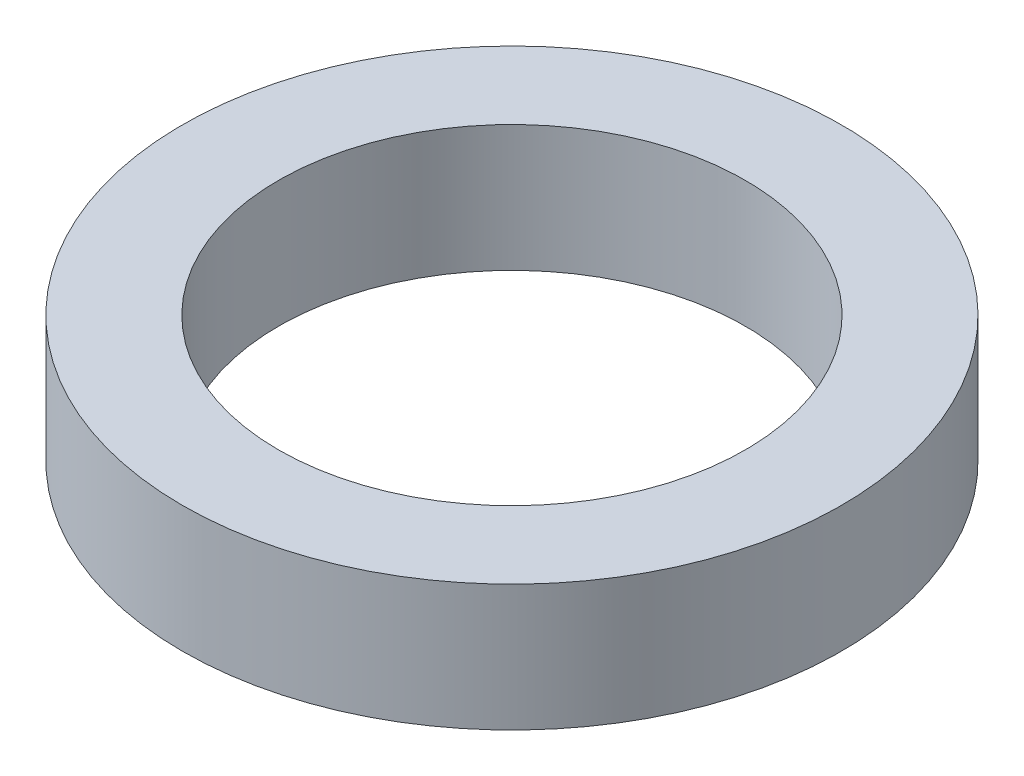
from build123d import *

# Parameters (mm, degrees)
SKETCH1_R           = 60
BOSS_EXTRUDE1_DEPTH = 23
SKETCH2_R           = 42.5
CUT_EXTRUDE1_DEPTH  = 88.914731416


with BuildPart() as part:
    # Sketch1 → Boss-Extrude1 (new body)
    with BuildSketch(Plane(origin=(0, 0, 0), x_dir=(1, 0, 0), z_dir=(0, 1, 0))):
        Circle(SKETCH1_R)
    extrude(amount=BOSS_EXTRUDE1_DEPTH)

    # Sketch2 → Cut-Extrude1 (cut, through all)
    with BuildSketch(Plane(origin=(0, 0, 0), x_dir=(1, 0, 0), z_dir=(0, 1, 0))):
        Circle(SKETCH2_R)
    extrude(amount=CUT_EXTRUDE1_DEPTH, mode=Mode.SUBTRACT)


solid = part.part
